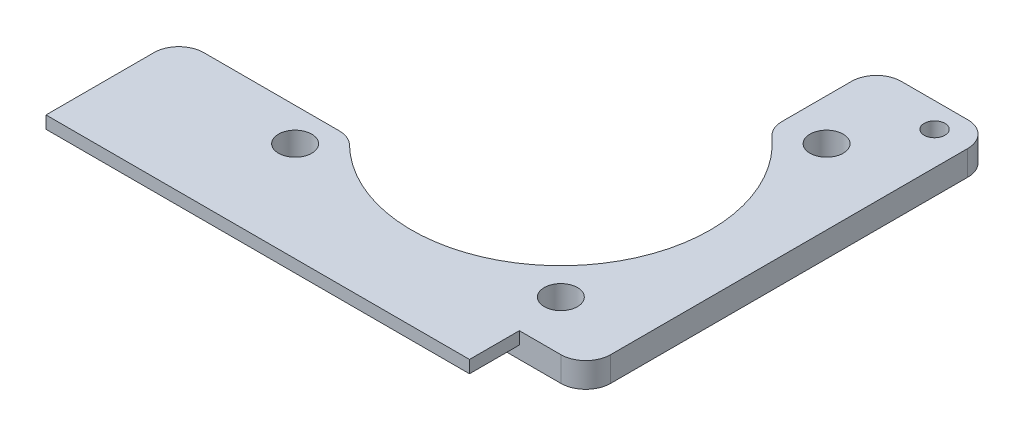
from build123d import *

# Parameters (mm, degrees)
SKETCH1_W           = 51
SKETCH1_H           = 6
BOSS_EXTRUDE1_DEPTH = 1.5
SKETCH3_R           = 2
SKETCH3_R_2         = 1.25
BOSS_EXTRUDE2_DEPTH = 3
FILLET1_R           = 3


with BuildPart() as part:
    # Sketch1 → Boss-Extrude1 (new body)
    with BuildSketch(Plane(origin=(0, 0, 0), x_dir=(1, 0, 0), z_dir=(0, 1, 0))):
        with Locations((25.5, -3)):
            Rectangle(SKETCH1_W, SKETCH1_H)
    extrude(amount=-BOSS_EXTRUDE1_DEPTH)

    # Sketch3 → Boss-Extrude2 (add)
    with BuildSketch(Plane(origin=(0, 0, 0), x_dir=(1, 0, 0), z_dir=(0, 1, 0))):
        with BuildLine():
            Line((59, 0), (59, 49))
            Line((59, 49), (45, 49))
            Line((45, 49), (45, 36.247806849))
            ThreePointArc((45, 36.247806849), (47.179400511, 9.740171202), (20.583592135, 10))
            Line((20.583592135, 10), (0, 10))
            Line((0, 10), (0, 0))
            Line((0, 0), (59, 0))
        make_face()
        with Locations((18, 6)):
            Circle(SKETCH3_R, mode=Mode.SUBTRACT)
        with Locations((50, 38)):
            Circle(SKETCH3_R, mode=Mode.SUBTRACT)
        with Locations((50, 6)):
            Circle(SKETCH3_R, mode=Mode.SUBTRACT)
        with Locations((55, 46)):
            Circle(SKETCH3_R_2, mode=Mode.SUBTRACT)
    extrude(amount=-BOSS_EXTRUDE2_DEPTH)

    # Fillet1
    fillet1_edges = [part.edges().sort_by_distance(p)[0] for p in [
        (59, -1.5, -49),
        (45, -1.5, -49),
        (0, -1.5, -10),
        (20.583592135, -1.5, -10),
        (45, -1.5, -36.247806849),
        (59, -1.5, 0),
    ]]
    fillet(fillet1_edges, radius=FILLET1_R)


solid = part.part
